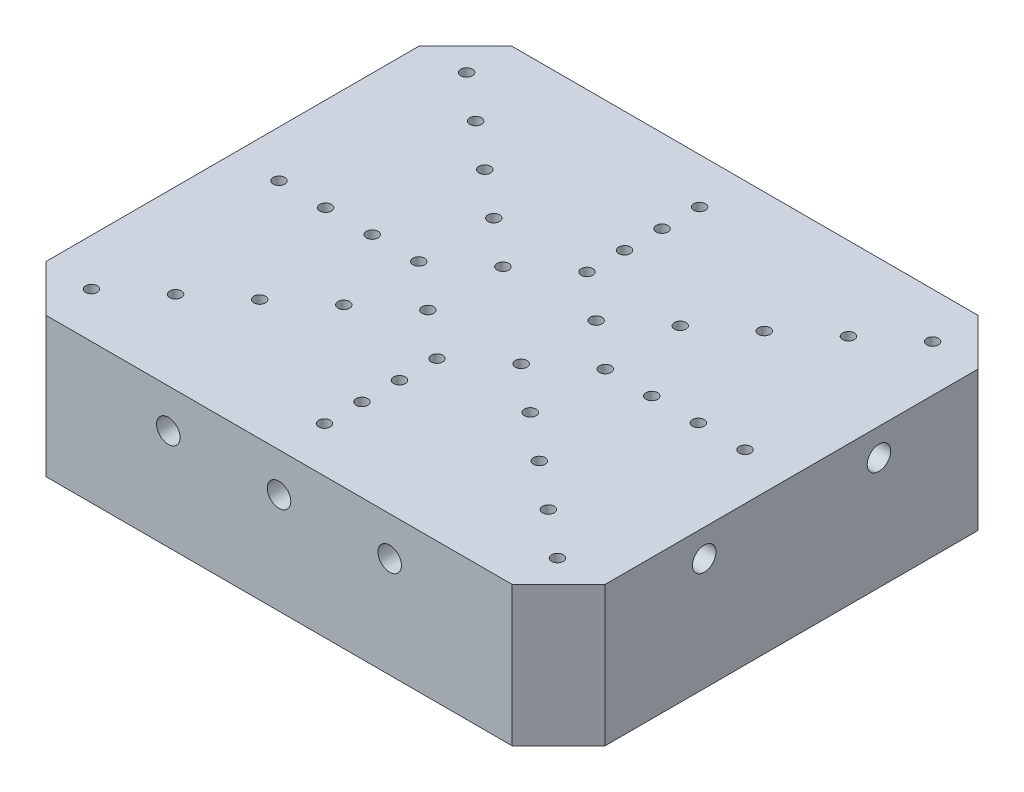
from build123d import *

# Parameters (mm, degrees)
SKETCH1_W                = 240
SKETCH1_H                = 200
BOSS_EXTRUDE1_DEPTH      = 60
CHAMFER1_SIZE            = 20
CUT_EXTRUDE1_DEPTH       = 56
SKETCH21_R               = 2.5
CUT_EXTRUDE16_DEPTH      = 54
CUT_EXTRUDE17_DEPTH      = 312.92947921
CUT_EXTRUDE17_DEPTH_BACK = 312.92947921
SKETCH24_R               = 5.05
CUT_EXTRUDE18_DEPTH      = 311.64449134
CUT_EXTRUDE18_DEPTH_BACK = 311.64449134
SKETCH27_R               = 5.05
SKETCH30_R               = 5
BOSS_EXTRUDE2_DEPTH      = 8.53


with BuildPart() as part:
    # Sketch1 → Boss-Extrude1 (new body)
    with BuildSketch(Plane(origin=(0, 0, 0), x_dir=(1, 0, 0), z_dir=(0, 1, 0))):
        with Locations((120, 100)):
            Rectangle(SKETCH1_W, SKETCH1_H)
    extrude(amount=BOSS_EXTRUDE1_DEPTH)

    # Chamfer1
    chamfer1_edges = [part.edges().sort_by_distance(p)[0] for p in [
        (0, 30, -200),
        (240, 30, -200),
        (240, 30, 0),
        (0, 30, 0),
    ]]
    chamfer(chamfer1_edges, length=CHAMFER1_SIZE)

    # Sketch2 → Cut-Extrude1 (cut)
    with BuildSketch(Plane.XZ):
        Polygon((10, -175), (10, -25), (25, -10), (215, -10), (230, -25), (230, -175), (215, -190), (25, -190), align=None)
    extrude(amount=-CUT_EXTRUDE1_DEPTH, mode=Mode.SUBTRACT)

    # Sketch21 → Cut-Extrude16 (cut)
    with BuildSketch(Plane.XZ.offset(-56)):
        with Locations((20, -19.512195122)):
            Circle(SKETCH21_R)
        with Locations((40, -35.609756098)):
            Circle(SKETCH21_R)
        with Locations((60, -51.707317073)):
            Circle(SKETCH21_R)
        with Locations((80, -67.804878049)):
            Circle(SKETCH21_R)
        with Locations((100, -83.902439024)):
            Circle(SKETCH21_R)
        with Locations((120, -19.512195122)):
            Circle(SKETCH21_R)
        with Locations((120, -35.609756098)):
            Circle(SKETCH21_R)
        with Locations((120, -51.707317073)):
            Circle(SKETCH21_R)
        with Locations((120, -67.804878049)):
            Circle(SKETCH21_R)
        with Locations((140, -83.902439024)):
            Circle(SKETCH21_R)
        with Locations((160, -67.804878049)):
            Circle(SKETCH21_R)
        with Locations((180, -51.707317073)):
            Circle(SKETCH21_R)
        with Locations((200, -35.609756098)):
            Circle(SKETCH21_R)
        with Locations((220, -19.512195122)):
            Circle(SKETCH21_R)
        with Locations((220, -100)):
            Circle(SKETCH21_R)
        with Locations((200, -100)):
            Circle(SKETCH21_R)
        with Locations((180, -100)):
            Circle(SKETCH21_R)
        with Locations((160, -100)):
            Circle(SKETCH21_R)
        with Locations((140, -116.097560976)):
            Circle(SKETCH21_R)
        with Locations((160, -132.195121951)):
            Circle(SKETCH21_R)
        with Locations((180, -148.292682927)):
            Circle(SKETCH21_R)
        with Locations((200, -164.390243902)):
            Circle(SKETCH21_R)
        with Locations((220, -180.487804878)):
            Circle(SKETCH21_R)
        with Locations((120, -180.487804878)):
            Circle(SKETCH21_R)
        with Locations((120, -164.390243902)):
            Circle(SKETCH21_R)
        with Locations((120, -148.292682927)):
            Circle(SKETCH21_R)
        with Locations((120, -132.195121951)):
            Circle(SKETCH21_R)
        with Locations((100, -116.097560976)):
            Circle(SKETCH21_R)
        with Locations((80, -132.195121951)):
            Circle(SKETCH21_R)
        with Locations((60, -148.292682927)):
            Circle(SKETCH21_R)
        with Locations((40, -164.390243902)):
            Circle(SKETCH21_R)
        with Locations((20, -180.487804878)):
            Circle(SKETCH21_R)
        with Locations((20, -100)):
            Circle(SKETCH21_R)
        with Locations((40, -100)):
            Circle(SKETCH21_R)
        with Locations((60, -100)):
            Circle(SKETCH21_R)
        with Locations((80, -100)):
            Circle(SKETCH21_R)
    extrude(amount=-CUT_EXTRUDE16_DEPTH, mode=Mode.SUBTRACT)

    # Sketch24 → Cut-Extrude17 (cut, two sides: drawn at the far end of the back side and taken through both)
    with BuildSketch(Plane.XY.offset(-190).offset(-CUT_EXTRUDE17_DEPTH_BACK)):
        with Locations((120, 43.3)):
            Circle(SKETCH24_R)
        with Locations((72.5, 43.3)):
            Circle(SKETCH24_R)
        with Locations((167.5, 43.3)):
            Circle(SKETCH24_R)
    extrude(amount=CUT_EXTRUDE17_DEPTH + CUT_EXTRUDE17_DEPTH_BACK, mode=Mode.SUBTRACT)

    # Sketch27 → Cut-Extrude18 (cut, two sides: drawn at the far end of the back side and taken through both)
    with BuildSketch(Plane(origin=(10, 0, 0), x_dir=(0, 0, -1), z_dir=(1, 0, 0)).offset(-CUT_EXTRUDE18_DEPTH_BACK)):
        with Locations((62.5, 48.3)):
            Circle(SKETCH27_R)
        with Locations((137.5, 48.3)):
            Circle(SKETCH27_R)
    extrude(amount=CUT_EXTRUDE18_DEPTH + CUT_EXTRUDE18_DEPTH_BACK, mode=Mode.SUBTRACT)


with BuildPart() as body_2:
    # Sketch30 → Boss-Extrude2 (new body)
    with BuildSketch(Plane.XZ.offset(-56)):
        with Locations((200, -35.609756098)):
            Circle(SKETCH30_R)
    extrude(amount=BOSS_EXTRUDE2_DEPTH)


solid = Compound([part.part, body_2.part])
